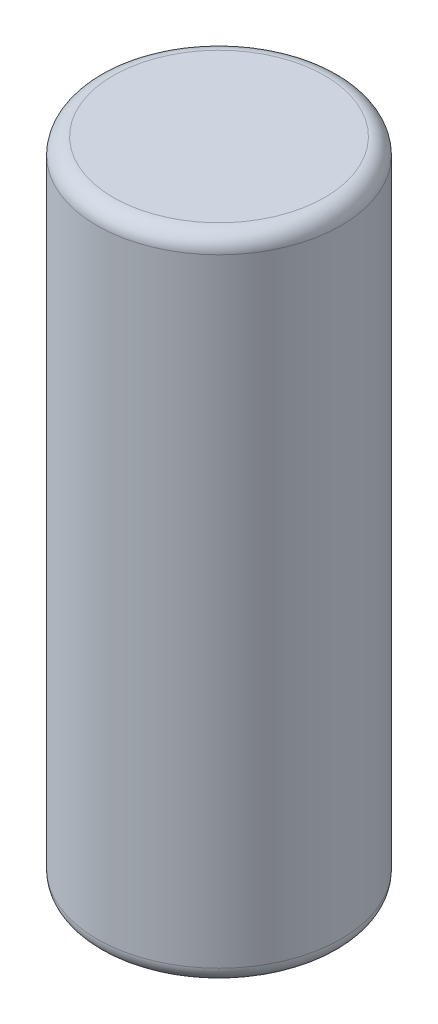
from build123d import *

# Parameters (mm, degrees)
SKETCH1_R           = 75
BOSS_EXTRUDE1_DEPTH = 400
FILLET1_R           = 10
FILLET2_R           = 10


with BuildPart() as part:
    # Sketch1 → Boss-Extrude1 (new body)
    with BuildSketch(Plane(origin=(0, 0, 0), x_dir=(1, 0, 0), z_dir=(0, 1, 0))):
        Circle(SKETCH1_R)
    extrude(amount=BOSS_EXTRUDE1_DEPTH)

    # Fillet1
    fillet1_edges = [part.edges().sort_by_distance(p)[0] for p in [
        (-75, 400, 0),
    ]]
    fillet(fillet1_edges, radius=FILLET1_R)

    # Fillet2
    fillet2_edges = [part.edges().sort_by_distance(p)[0] for p in [
        (-75, 0, 0),
    ]]
    fillet(fillet2_edges, radius=FILLET2_R)


solid = part.part
